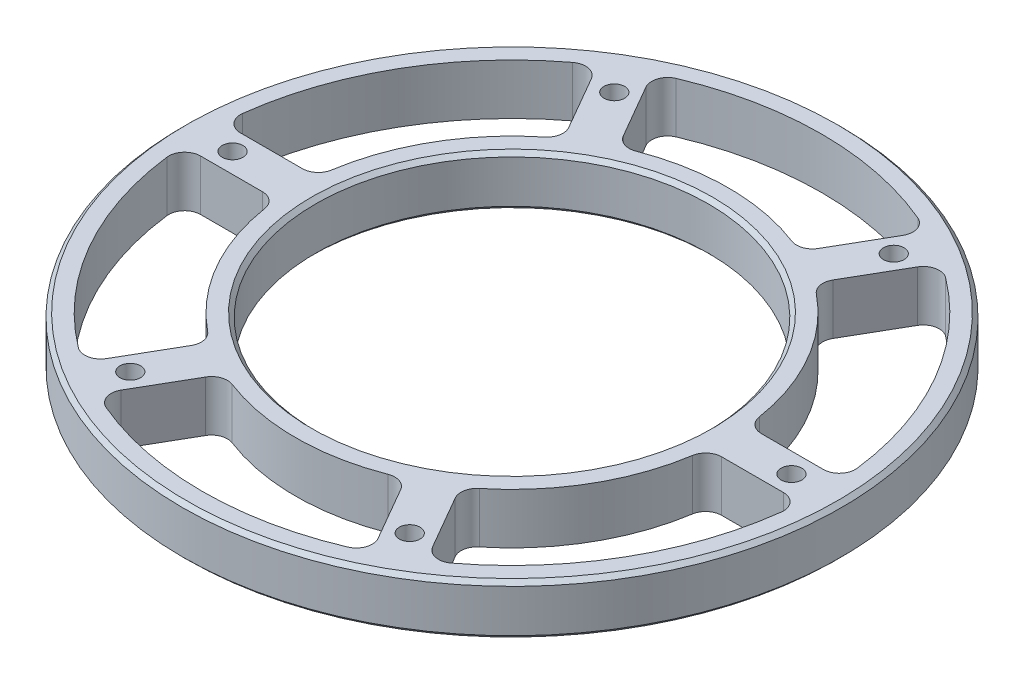
from build123d import *

# Parameters (mm, degrees)
F_6_0_204_DIAMETER_HOLE1_D = 5.1816
CIRPATTERN3_COUNT          = 6
CUT_EXTRUDE1_DEPTH         = 118.43208675655899
FILLET1_R                  = 4
CIRPATTERN4_COUNT          = 6
FILLET1_OF_CIRPATTERN4_R   = 4
CHAMFER1_SIZE              = 1
CHAMFER2_SIZE              = 1


with BuildPart() as part:
    # Sketch2 → Revolve1 (revolve)
    with BuildSketch(Plane(origin=(0, 0, 0), x_dir=(0, 0, -1), z_dir=(1, 0, 0))):
        Polygon((-49.2125, -4.7e-16), (-82.55, -4.08e-15), (-82.55, 12.699999999999996), (-49.2125, 12.699999999999996), align=None)
    revolve(axis=Axis((0, -0.500000000000003, 0), (0, 1, 0)))

    # #6 (0.204) Diameter Hole1 (through all)
    with Locations(Plane(origin=(0, 12.699999999999996, 0), x_dir=(1, 0, 0), z_dir=(0, 1, 0))):
        with Locations((-35, 60.621778265)):
            f_6_0_204_diameter_hole1 = Hole(F_6_0_204_DIAMETER_HOLE1_D / 2)

    # CirPattern3: #6 (0.204) Diameter Hole1 ×6 about axis
    cirpattern3_axis = Axis((0, -0.500000000000003, 0), (0, 1, 0))
    for i in range(1, CIRPATTERN3_COUNT):
        add(f_6_0_204_diameter_hole1.rotate(cirpattern3_axis, i * 360 / CIRPATTERN3_COUNT), mode=Mode.SUBTRACT)

    # Sketch8 → Cut-Extrude1 (cut, through all)
    with BuildSketch(Plane(origin=(0, 12.699999999999996, 0), x_dir=(1, 0, 0), z_dir=(0, 1, 0))):
        with BuildLine():
            Line((-22.660589701137386, 49.24929269184184), (-34.36419588509058, 69.52053323422602))
            ThreePointArc((-34.36419588509058, 69.52053323422602), (4.75e-15, 77.55000000000001), (34.36419588509058, 69.52053323422602))
            Line((34.36419588509058, 69.52053323422602), (22.660589701137386, 49.24929269184184))
            ThreePointArc((22.660589701137386, 49.24929269184184), (3.32e-15, 54.2125), (-22.660589701137386, 49.24929269184184))
        make_face()
    cut_extrude1 = extrude(amount=-CUT_EXTRUDE1_DEPTH, mode=Mode.SUBTRACT)

    # Fillet1
    fillet1_edges = [part.edges().sort_by_distance(p)[0] for p in [
        (-22.660589701137383, 6.349999999999998, -49.24929269184184),
        (22.66058970113739, 6.349999999999998, -49.249292691841845),
        (34.36419588509058, 6.349999999999998, -69.52053323422604),
        (-34.36419588509058, 6.349999999999998, -69.52053323422604),
    ]]
    fillet(fillet1_edges, radius=FILLET1_R)

    # CirPattern4: Cut-Extrude1 ×6 about axis
    cirpattern4_axis = Axis((0, -0.500000000000003, 0), (0, 1, 0))
    for i in range(1, CIRPATTERN4_COUNT):
        add(cut_extrude1.rotate(cirpattern4_axis, i * 360 / CIRPATTERN4_COUNT), mode=Mode.SUBTRACT)

    # Fillet1 of CirPattern4
    fillet1_of_cirpattern4_edges = [part.edges().sort_by_distance(p)[0] for p in [
        (-53.98143344011902, 6.349999999999998, -4.9999999999999325),
        (-31.320843738981637, 6.349999999999998, -44.24929269184193),
        (-43.02444992293479, 6.349999999999998, -64.52053323422614),
        (-77.38864580802537, 6.349999999999998, -4.999999999999911),
        (-31.32084373898165, 6.349999999999998, 44.2492926918419),
        (-53.981433440119034, 6.349999999999998, 4.999999999999911),
        (-77.38864580802539, 6.349999999999998, 4.999999999999886),
        (-43.024449922934814, 6.349999999999998, 64.52053323422612),
        (22.660589701137376, 6.349999999999998, 49.24929269184184),
        (-22.660589701137397, 6.349999999999998, 49.249292691841845),
        (-34.36419588509059, 6.349999999999998, 69.52053323422604),
        (34.364195885090574, 6.349999999999998, 69.52053323422604),
        (53.98143344011902, 6.349999999999998, 4.999999999999954),
        (31.320843738981615, 6.349999999999998, 44.24929269184194),
        (43.024449922934764, 6.349999999999998, 64.52053323422615),
        (77.38864580802537, 6.349999999999998, 4.99999999999994),
        (31.320843738981637, 6.349999999999998, -44.249292691841916),
        (53.981433440119034, 6.349999999999998, -4.9999999999999325),
        (77.38864580802537, 6.349999999999998, -4.999999999999911),
        (43.02444992293479, 6.349999999999998, -64.52053323422614),
    ]]
    fillet(fillet1_of_cirpattern4_edges, radius=FILLET1_OF_CIRPATTERN4_R)

    # Chamfer1
    chamfer1_edges = [part.edges().sort_by_distance(p)[0] for p in [
        (6.03e-15, 12.699999999999996, -49.2125),
        (6.03e-15, -4.4e-16, -49.2125),
    ]]
    chamfer(chamfer1_edges, length=CHAMFER1_SIZE)

    # Chamfer2
    chamfer2_edges = [part.edges().sort_by_distance(p)[0] for p in [
        (4.677e-14, 12.699999999999996, -82.55),
        (4.677e-14, -4.11e-15, -82.55),
    ]]
    chamfer(chamfer2_edges, length=CHAMFER2_SIZE)


solid = part.part
